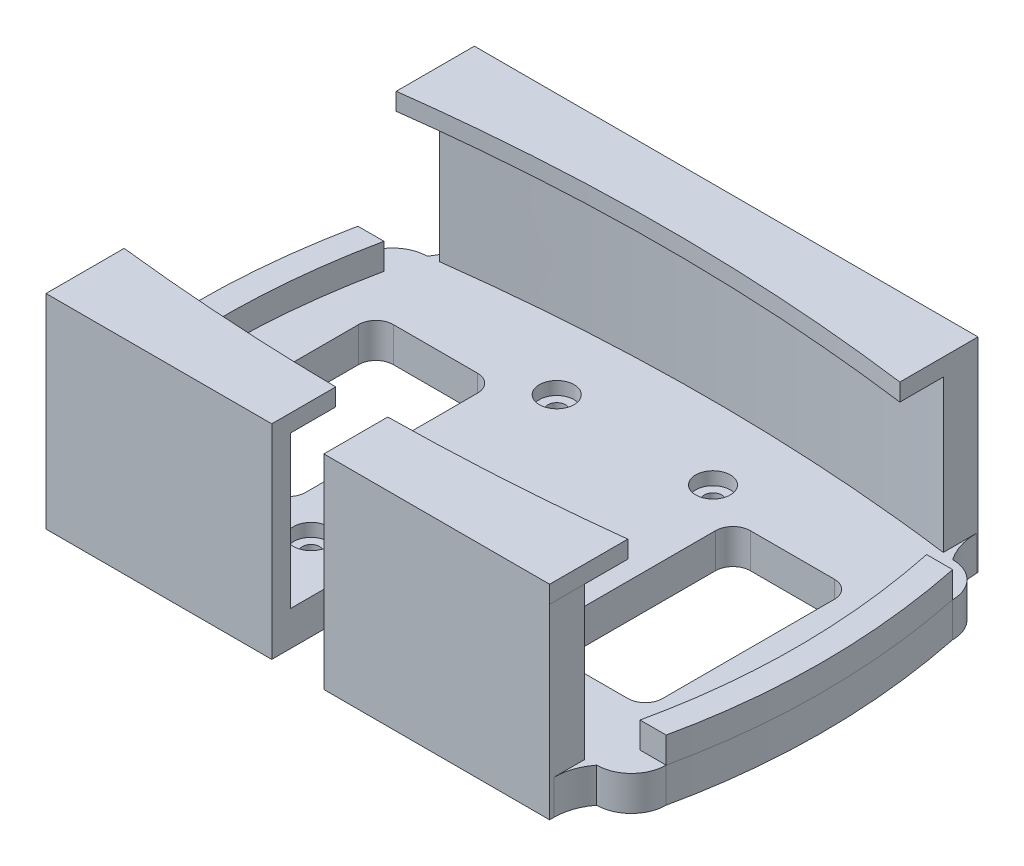
from build123d import *

# Parameters (mm, degrees)
BOSS_EXTRUDE1_DEPTH   = 4
CUT_EXTRUDE1_DEPTH    = 17
BOSS_EXTRUDE2_DEPTH   = 19.5
BOSS_EXTRUDE3_DEPTH   = 4
SKETCH6_W             = 58
SKETCH6_H             = 2
BOSS_EXTRUDE4_DEPTH   = 9
CUT_EXTRUDE2_DEPTH    = 7
FILLET1_R             = 7
BOSS_EXTRUDE5_DEPTH   = 23.5
SKETCH9_W             = 26
SKETCH9_H             = 2
SKETCH9_W_2           = 26.001587477
BOSS_EXTRUDE6_DEPTH   = 9
CUT_EXTRUDE3_DEPTH    = 10
SKETCH11_R            = 1
CUT_EXTRUDE4_DEPTH    = 10
SKETCH12_R            = 2
CUT_EXTRUDE5_DEPTH    = 1.5
SKETCH13_W            = 13.69136931
SKETCH13_H            = 23.795369164
CUT_EXTRUDE6_DEPTH    = 21.5
FILLET2_R             = 2
FILLET2_OF_MIRROR11_R = 2
FILLET3_R             = 6
BOSS_EXTRUDE7_DEPTH   = 7


with BuildPart() as part:
    # Sketch1 → Boss-Extrude1 (new body)
    with BuildSketch(Plane(origin=(0, 0, 0), x_dir=(1, 0, 0), z_dir=(0, 1, 0))):
        with BuildLine():
            ThreePointArc((30.25, 20.5), (33.078427125, 19.328427125), (34.25, 16.5))
            add(Edge.make_bspline(
                [(34.25, 16.5), (37.722666951, -0.526670932), (34.25, -16.5)],
                knots=[0, 0, 0, 0.709821526, 0.709821526, 0.709821526], degree=2))
            ThreePointArc((34.25, -16.5), (33.078427125, -19.328427125), (30.25, -20.5))
            add(Edge.make_bspline(
                [(-30.25, -20.5), (0.344261678, -24.605611324), (30.25, -20.5)],
                knots=[0, 0, 0, 0.814994135, 0.814994135, 0.814994135], degree=2))
            ThreePointArc((-30.25, -20.5), (-33.078427125, -19.328427125), (-34.25, -16.5))
            add(Edge.make_bspline(
                [(-34.25, 16.5), (-37.722666951, -0.526670933), (-34.25, -16.5)],
                knots=[0, 0, 0, 0.709821526, 0.709821526, 0.709821526], degree=2))
            ThreePointArc((-34.25, 16.5), (-33.078427125, 19.328427125), (-30.25, 20.5))
            add(Edge.make_bspline(
                [(-30.25, 20.5), (0.344261678, 24.605611324), (30.25, 20.5)],
                knots=[0, 0, 0, 0.814994135, 0.814994135, 0.814994135], degree=2))
        make_face()
    extrude(amount=BOSS_EXTRUDE1_DEPTH)

    # Sketch2 → Cut-Extrude1 (cut)
    with BuildSketch(Plane(origin=(0, 4, 0), x_dir=(1, 0, 0), z_dir=(0, 1, 0))):
        with BuildLine():
            Line((-3, 0), (-3, -22.530259042))
            add(Edge.make_bspline(
                [(-3, -22.530259042), (0.003385515, -22.572928062), (3, -22.534846829)],
                knots=[0, 0, 0, 1, 1, 1], degree=2))
            Line((3, -22.534846829), (3, 0))
            Line((3, 0), (-3, 0))
        make_face()
    extrude(amount=-CUT_EXTRUDE1_DEPTH, mode=Mode.SUBTRACT)



with BuildPart() as body_2:
    # Sketch3 → Boss-Extrude2 (new body)
    with BuildSketch(Plane(origin=(0, 4, 0), x_dir=(1, 0, 0), z_dir=(0, 1, 0))):
        with BuildLine():
            Line((-29, 20.664354546), (-29, 24.667980394))
            Line((-29, 24.667980394), (29, 24.667980394))
            Line((29, 24.667980394), (29, 20.667980394))
            add(Edge.make_bspline(
                [(29, 20.667980394), (0.316394821, 24.439442983), (-29, 20.664354546)],
                knots=[0, 0, 0, 1, 1, 1], degree=2))
        make_face()
    extrude(amount=BOSS_EXTRUDE2_DEPTH)


with BuildPart() as part_1:
    add(part.part)

    add(body_2.part)  # Boss-Extrude3 merges body 2
    # Sketch4 → Boss-Extrude3 (add)
    with BuildSketch(Plane.XZ.offset(-4)):
        with BuildLine():
            Line((-29.000000006, -20.664354545), (-29, -24.667980394))
            Line((-29, -24.667980394), (29, -24.667980394))
            Line((29, -24.667980394), (29, -20.667980394))
            add(Edge.make_bspline(
                [(29, -20.667980394), (0.316394818, -24.439442983), (-29.000000006, -20.664354545)],
                knots=[0, 0, 0, 1, 1, 1], degree=2))
        make_face()
    extrude(amount=BOSS_EXTRUDE3_DEPTH)

    # Sketch6 → Boss-Extrude4 (add)
    with BuildSketch(Plane(origin=(0, 0, -24.667980394), x_dir=(-1, 0, 0), z_dir=(0, 0, -1))):
        with Locations((0, 22.5)):
            Rectangle(SKETCH6_W, SKETCH6_H)
    extrude(amount=-BOSS_EXTRUDE4_DEPTH)

    # Sketch7 → Cut-Extrude2 (cut)
    with BuildSketch(Plane(origin=(0, 23.5, 0), x_dir=(1, 0, 0), z_dir=(0, 1, 0))):
        with BuildLine():
            Line((-29, 15.667980394), (29, 15.667980394))
            add(Edge.make_bspline(
                [(-29, 15.667980394), (0.2737777, 19.470424078), (29, 15.667980394)],
                knots=[0, 0, 0, 0.915261327, 0.915261327, 0.915261327], degree=2))
        make_face()
    extrude(amount=-CUT_EXTRUDE2_DEPTH, mode=Mode.SUBTRACT)

    # Fillet1
    # the kernel refuses this fillet: 7 mm, written as the material it adds along each edge
    with BuildSketch(Plane(origin=(-29.000000006, 4, -20.664354545), x_dir=(-0.9914665134907249, 0, 0.13036162252191422), z_dir=(0, -1, 0))) as fillet1_piece_1:
        with BuildLine():
            CenterArc((6.441264071, 4.707691972), FILLET1_R, 187.490489673, 34.771943947)
            Line((-0.499001522, 3.795160604), (-0.637806834, 3.776909977))
            Line((-0.637806834, 3.776909977), (-0.138805312, -0.018250627))
            Line((-0.138805312, -0.018250627), (0.000373506, -0.139999502))
            ThreePointArc((0.000373506, -0.139999502), (0.630379223, -0.139159591), (1.157148553, -0.094153839))
            Line((1.157148553, -0.094153839), (1.260758661, 0))
        make_face()
    extrude(amount=4)
    with BuildSketch(Plane(origin=(29, 4, -20.667980394), x_dir=(0.9910909157815452, 0, 0.13318707390470766), z_dir=(0, -1, 0))) as fillet1_piece_2:
        with BuildLine():
            CenterArc((6.428302474, -4.722438864), FILLET1_R, 137.57425577, 34.771944029)
            Line((-0.509333936, -3.790129346), (-0.648086665, -3.771483156))
            Line((-0.648086665, -3.771483156), (-0.138752728, 0.01864619))
            Line((-0.138752728, 0.01864619), (0.000398861, 0.139999432))
            ThreePointArc((0.000398861, 0.139999432), (0.630618203, 0.139101807), (1.157895141, 0.094448777))
            Line((1.157895141, 0.094448777), (1.261236462, 0))
        make_face()
    extrude(amount=4)

    # Sketch8 → Boss-Extrude5 (add)
    with BuildSketch(Plane.XZ):
        with BuildLine():
            add(Edge.make_bspline(
                [(2.999999846, 22.534846831), (16.064348435, 22.368823982), (29, 20.667980394)],
                knots=[0, 0, 0, 0.953900197, 0.953900197, 0.953900197], degree=2))
            Line((29, 20.667980394), (29, 24.667980394))
            Line((29, 24.667980394), (2.999999846, 24.667980394))
            Line((2.999999846, 24.667980394), (2.999999846, 22.534846831))
        make_face()
        with BuildLine():
            Line((-3, 24.667980394), (-29, 24.667980394))
            Line((-29, 24.667980394), (-29, 20.664354545))
            add(Edge.make_bspline(
                [(-29, 20.664354545), (-15.937182308, 22.346460832), (-3, 22.530259042)],
                knots=[0.045651019, 0.045651019, 0.045651019, 1, 1, 1], degree=2))
            Line((-3, 22.530259042), (-3, 24.667980394))
        make_face()
    extrude(amount=-BOSS_EXTRUDE5_DEPTH)

    # Sketch9 → Boss-Extrude6 (add)
    with BuildSketch(Plane.XY.offset(24.667980394)):
        with Locations((-16, 22.5)):
            Rectangle(SKETCH9_W, SKETCH9_H)
        with Locations((16.000793585, 22.5)):
            Rectangle(SKETCH9_W_2, SKETCH9_H)
    extrude(amount=-BOSS_EXTRUDE6_DEPTH)

    # Sketch10 → Cut-Extrude3 (cut)
    with BuildSketch(Plane(origin=(0, 23.5, 0), x_dir=(1, 0, 0), z_dir=(0, 1, 0))):
        with BuildLine():
            Line((-29, -15.667980394), (29.001587323, -15.667980394))
            add(Edge.make_bspline(
                [(-29, -15.667980394), (0.20822973, -18.978019575), (29.001587323, -15.667980394)],
                knots=[0, 0, 0, 0.914206728, 0.914206728, 0.914206728], degree=2))
        make_face()
    extrude(amount=-CUT_EXTRUDE3_DEPTH, mode=Mode.SUBTRACT)

    # Sketch11 → Cut-Extrude4 (cut)
    with BuildSketch(Plane(origin=(0, 4, 0), x_dir=(1, 0, 0), z_dir=(0, 1, 0))):
        with Locations(Location((-9, 14.15, 0), (0, 0, 270))):
            Circle(SKETCH11_R)
        with Locations(Location((-9, -14.15, 0), (0, 0, 270))):
            Circle(SKETCH11_R)
    cut_extrude4 = extrude(amount=-CUT_EXTRUDE4_DEPTH, mode=Mode.SUBTRACT)

    # Sketch12 → Cut-Extrude5 (cut)
    with BuildSketch(Plane(origin=(0, 4, 0), x_dir=(1, 0, 0), z_dir=(0, 1, 0))):
        with Locations(Location((-9, 14.15, 0), (0, 0, 270))):
            Circle(SKETCH12_R)
        with Locations(Location((-9, -14.15, 0), (0, 0, 270))):
            Circle(SKETCH12_R)
    cut_extrude5 = extrude(amount=-CUT_EXTRUDE5_DEPTH, mode=Mode.SUBTRACT)

    # Mirror10: Cut-Extrude4, Cut-Extrude5 across plane
    add(cut_extrude4.mirror(Plane.ZY), mode=Mode.SUBTRACT)
    add(cut_extrude5.mirror(Plane.ZY), mode=Mode.SUBTRACT)

    # Sketch13 → Cut-Extrude6 (cut)
    with BuildSketch(Plane(origin=(0, 4, 0), x_dir=(1, 0, 0), z_dir=(0, 1, 0))):
        with Locations((-20.556344598, -0.164609633)):
            Rectangle(SKETCH13_W, SKETCH13_H)
    cut_extrude6 = extrude(amount=-CUT_EXTRUDE6_DEPTH, mode=Mode.SUBTRACT)

    # Fillet2
    fillet2_edges = [part_1.edges().sort_by_distance(p)[0] for p in [
        (-13.710659943, 2, -11.733074949),
        (-13.710659943, 2, 12.062294215),
        (-27.402029253, 2, 12.062294215),
        (-27.402029253, 2, -11.733074949),
    ]]
    fillet(fillet2_edges, radius=FILLET2_R)

    # Mirror11: Cut-Extrude6 across plane
    add(cut_extrude6.mirror(Plane.ZY), mode=Mode.SUBTRACT)

    # Fillet2 of Mirror11
    fillet2_of_mirror11_edges = [part_1.edges().sort_by_distance(p)[0] for p in [
        (13.710659959, 2, -11.73307493),
        (13.710659926, 2, 12.062294234),
        (27.402029236, 2, 12.062294253),
        (27.40202927, 2, -11.733074911),
    ]]
    fillet(fillet2_of_mirror11_edges, radius=FILLET2_OF_MIRROR11_R)

    # Fillet3
    # the kernel refuses this fillet: 6 mm, written as the material it adds along each edge
    with BuildSketch(Plane(origin=(-29, 0, 20.664354545), x_dir=(-0.9914665134873252, 0, -0.13036162254777076), z_dir=(0, 1, 0))) as fillet3_piece_1:
        with BuildLine():
            CenterArc((5.492355455, 4.253655913), FILLET3_R, 187.490489592, 37.658462004)
            Line((-0.456443626, 3.471486178), (-0.575419608, 3.455842783))
            Line((-0.575419608, 3.455842783), (-0.118975982, -0.015643395))
            Line((-0.118975982, -0.015643395), (0.000320148, -0.119999573))
            ThreePointArc((0.000320148, -0.119999573), (0.630379241, -0.119159591), (1.176126731, -0.085073118))
            Line((1.176126731, -0.085073118), (1.260758667, 0))
        make_face()
    extrude(amount=4)
    with BuildSketch(Plane(origin=(29, 0, 20.667980394), x_dir=(0.9910909157697056, 0, -0.1331870739928102), z_dir=(0, 1, 0))) as fillet3_piece_2:
        with BuildLine():
            CenterArc((5.480691848, -4.265699972), FILLET3_R, 134.68773779, 37.658462005)
            Line((-0.465853647, -3.466577528), (-0.584784557, -3.450595079))
            Line((-0.584784557, -3.450595079), (-0.11893091, 0.015982449))
            Line((-0.11893091, 0.015982449), (0.000341881, 0.119999513))
            ThreePointArc((0.000341881, 0.119999513), (0.630618207, 0.119101807), (1.176847354, 0.085313999))
            Line((1.176847354, 0.085313999), (1.261236462, 0))
        make_face()
    extrude(amount=4)

    # Sketch14 → Boss-Extrude7 (add)
    with BuildSketch(Plane.XZ):
        with BuildLine():
            Line((-31.25, 16.5), (-34.25, 16.5))
            add(Edge.make_bspline(
                [(-34.25, -16.5), (-37.722666951, 0.526670933), (-34.25, 16.5)],
                knots=[0, 0, 0, 1, 1, 1], degree=2))
            Line((-34.25, -16.5), (-31.25, -16.5))
            add(Edge.make_bspline(
                [(-31.25, -16.5), (-34.771209982, 0.410301421), (-31.25, 16.5)],
                knots=[0, 0, 0, 1, 1, 1], degree=2))
        make_face()
    boss_extrude7 = extrude(amount=-BOSS_EXTRUDE7_DEPTH)

    # Mirror12: Boss-Extrude7 across plane
    add(boss_extrude7.mirror(Plane.ZY))


solid = part_1.part
